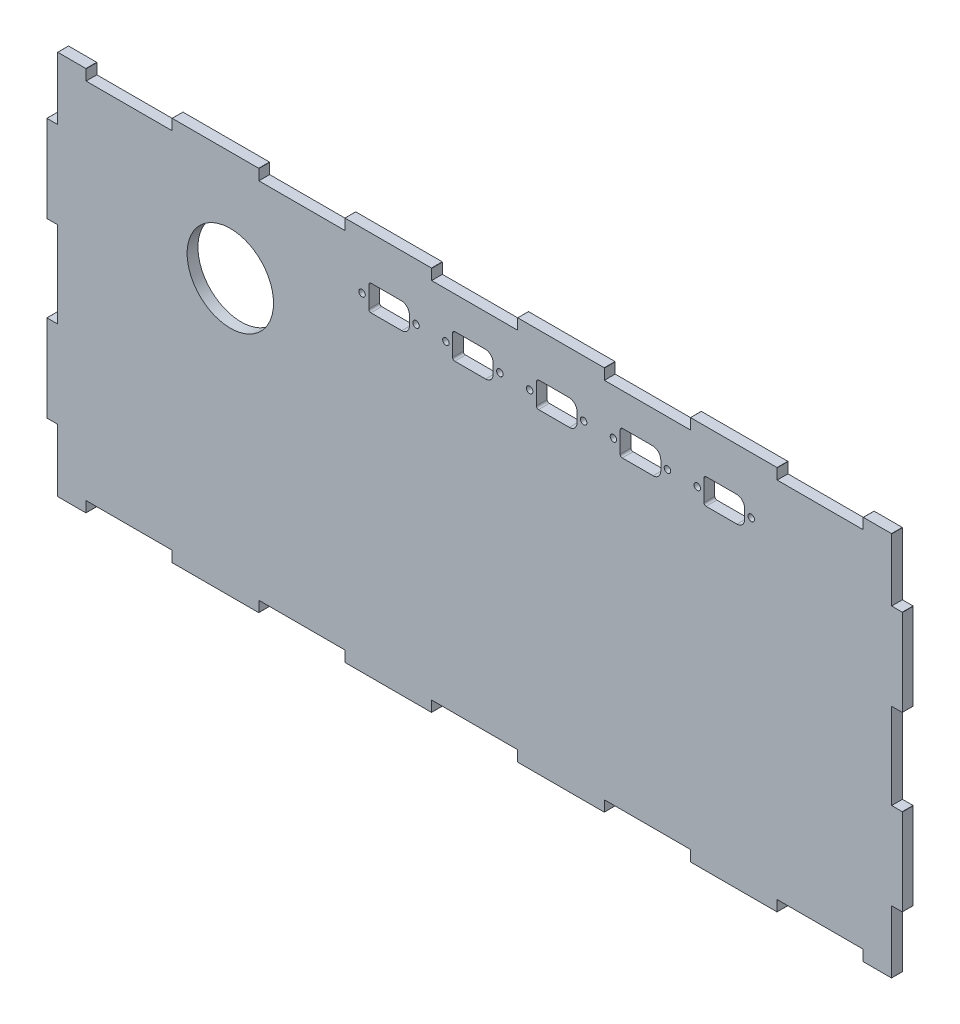
from build123d import *

# Parameters (mm, degrees)
BOSS_EXTRUDE1_DEPTH = 5
SKETCH2_R           = 1.5
CUT_EXTRUDE1_DEPTH  = 218.272685812
SKETCH3_R           = 20
CUT_EXTRUDE2_DEPTH  = 218.272685812


with BuildPart() as part:
    # Model → Boss-Extrude1 (new body)
    with BuildSketch(Plane.XY):
        Polygon((-179.94, -89.08), (-179.93, -89.07), (-179.92, -89.05), (-179.91, -89.04), (-179.9, -89.02), (-179.9, -84.1), (-140.1, -84.1), (-140.1, -89.02), (-140.08, -89.06), (-140.07, -89.07), (-140.05, -89.08), (-140.04, -89.09), (-140.02, -89.1), (-99.98, -89.1), (-99.94, -89.08), (-99.93, -89.07), (-99.92, -89.05), (-99.91, -89.04), (-99.9, -89.02), (-99.9, -84.1), (-60.1, -84.1), (-60.1, -89.02), (-60.08, -89.06), (-60.07, -89.07), (-60.05, -89.08), (-60.04, -89.09), (-60.02, -89.1), (-19.98, -89.1), (-19.94, -89.08), (-19.93, -89.07), (-19.92, -89.05), (-19.91, -89.04), (-19.9, -89.02), (-19.9, -84.1), (19.9, -84.1), (19.9, -89.02), (19.92, -89.06), (19.93, -89.07), (19.95, -89.08), (19.96, -89.09), (19.98, -89.1), (60.02, -89.1), (60.06, -89.08), (60.07, -89.07), (60.08, -89.05), (60.09, -89.04), (60.1, -89.02), (60.1, -84.1), (99.9, -84.1), (99.9, -89.02), (99.92, -89.06), (99.93, -89.07), (99.95, -89.08), (99.96, -89.09), (99.98, -89.1), (140.02, -89.1), (140.06, -89.08), (140.07, -89.07), (140.08, -89.05), (140.09, -89.04), (140.1, -89.02), (140.1, -84.1), (179.9, -84.1), (179.9, -89.02), (179.92, -89.06), (179.93, -89.07), (179.95, -89.08), (179.96, -89.09), (179.98, -89.1), (193.02, -89.1), (193.06, -89.08), (193.07, -89.07), (193.08, -89.05), (193.09, -89.04), (193.1, -89.02), (193.1, -60.1), (198.02, -60.1), (198.06, -60.08), (198.07, -60.07), (198.08, -60.05), (198.09, -60.04), (198.1, -60.02), (198.1, -19.98), (198.08, -19.94), (198.07, -19.93), (198.05, -19.92), (198.04, -19.91), (198.02, -19.9), (193.1, -19.9), (193.1, 19.9), (198.02, 19.9), (198.06, 19.92), (198.07, 19.93), (198.08, 19.95), (198.09, 19.96), (198.1, 19.98), (198.1, 60.02), (198.08, 60.06), (198.07, 60.07), (198.05, 60.08), (198.04, 60.09), (198.02, 60.1), (193.1, 60.1), (193.1, 89.02), (193.08, 89.06), (193.07, 89.07), (193.05, 89.08), (193.04, 89.09), (193.02, 89.1), (179.98, 89.1), (179.94, 89.08), (179.93, 89.07), (179.92, 89.05), (179.91, 89.04), (179.9, 89.02), (179.9, 84.1), (140.1, 84.1), (140.1, 89.02), (140.08, 89.06), (140.07, 89.07), (140.05, 89.08), (140.04, 89.09), (140.02, 89.1), (99.98, 89.1), (99.94, 89.08), (99.93, 89.07), (99.92, 89.05), (99.91, 89.04), (99.9, 89.02), (99.9, 84.1), (60.1, 84.1), (60.1, 89.02), (60.08, 89.06), (60.07, 89.07), (60.05, 89.08), (60.04, 89.09), (60.02, 89.1), (19.98, 89.1), (19.94, 89.08), (19.93, 89.07), (19.92, 89.05), (19.91, 89.04), (19.9, 89.02), (19.9, 84.1), (-19.9, 84.1), (-19.9, 89.02), (-19.92, 89.06), (-19.93, 89.07), (-19.95, 89.08), (-19.96, 89.09), (-19.98, 89.1), (-60.02, 89.1), (-60.06, 89.08), (-60.07, 89.07), (-60.08, 89.05), (-60.09, 89.04), (-60.1, 89.02), (-60.1, 84.1), (-99.9, 84.1), (-99.9, 89.02), (-99.92, 89.06), (-99.93, 89.07), (-99.95, 89.08), (-99.96, 89.09), (-99.98, 89.1), (-140.02, 89.1), (-140.06, 89.08), (-140.07, 89.07), (-140.08, 89.05), (-140.09, 89.04), (-140.1, 89.02), (-140.1, 84.1), (-179.9, 84.1), (-179.9, 89.02), (-179.92, 89.06), (-179.93, 89.07), (-179.95, 89.08), (-179.96, 89.09), (-179.98, 89.1), (-193.02, 89.1), (-193.06, 89.08), (-193.07, 89.07), (-193.08, 89.05), (-193.09, 89.04), (-193.1, 89.02), (-193.1, 60.1), (-198.02, 60.1), (-198.06, 60.08), (-198.07, 60.07), (-198.08, 60.05), (-198.09, 60.04), (-198.1, 60.02), (-198.1, 19.98), (-198.08, 19.94), (-198.07, 19.93), (-198.05, 19.92), (-198.04, 19.91), (-198.02, 19.9), (-193.1, 19.9), (-193.1, -19.9), (-198.02, -19.9), (-198.06, -19.92), (-198.07, -19.93), (-198.08, -19.95), (-198.09, -19.96), (-198.1, -19.98), (-198.1, -60.02), (-198.08, -60.06), (-198.07, -60.07), (-198.05, -60.08), (-198.04, -60.09), (-198.02, -60.1), (-193.1, -60.1), (-193.1, -89.02), (-193.08, -89.06), (-193.07, -89.07), (-193.05, -89.08), (-193.04, -89.09), (-193.02, -89.1), (-179.98, -89.1), align=None)
    extrude(amount=BOSS_EXTRUDE1_DEPTH)

    # Sketch2 → Cut-Extrude1 (cut, through all)
    with BuildSketch(Plane.XY.offset(5)):
        with Locations((-52.108840949, 62.97)):
            Circle(SKETCH2_R)
        with Locations((-27.108840949, 62.97)):
            Circle(SKETCH2_R)
        with Locations((-13.308840949, 62.97)):
            Circle(SKETCH2_R)
        with Locations((11.691159051, 62.97)):
            Circle(SKETCH2_R)
        with Locations((25.491159051, 62.97)):
            Circle(SKETCH2_R)
        with Locations((50.491159051, 62.97)):
            Circle(SKETCH2_R)
        with Locations((64.291159051, 62.97)):
            Circle(SKETCH2_R)
        with Locations((89.291159051, 62.97)):
            Circle(SKETCH2_R)
        with Locations((103.091159051, 62.97)):
            Circle(SKETCH2_R)
        with Locations((128.091159051, 62.97)):
            Circle(SKETCH2_R)
        with BuildLine():
            Line((-33.733840949, 57.12), (-48.008840949, 57.12))
            ThreePointArc((-48.008840949, 57.12), (-48.71594773, 57.412893219), (-49.008840949, 58.12))
            Line((-49.008840949, 58.12), (-49.008840949, 67.82))
            ThreePointArc((-49.008840949, 67.82), (-48.657369086, 68.668528137), (-47.808840949, 69.02))
            Line((-47.808840949, 69.02), (-33.933840949, 69.02))
            ThreePointArc((-33.933840949, 69.02), (-31.299868189, 67.92897276), (-30.208840949, 65.295))
            Line((-30.208840949, 65.295), (-30.208840949, 60.645))
            ThreePointArc((-30.208840949, 60.645), (-31.241289545, 58.152448596), (-33.733840949, 57.12))
        make_face()
        with BuildLine():
            Line((5.066159051, 57.12), (-9.208840949, 57.12))
            ThreePointArc((-9.208840949, 57.12), (-9.91594773, 57.412893219), (-10.208840949, 58.12))
            Line((-10.208840949, 58.12), (-10.208840949, 67.82))
            ThreePointArc((-10.208840949, 67.82), (-9.857369086, 68.668528137), (-9.008840949, 69.02))
            Line((-9.008840949, 69.02), (4.866159051, 69.02))
            ThreePointArc((4.866159051, 69.02), (7.500131811, 67.92897276), (8.591159051, 65.295))
            Line((8.591159051, 65.295), (8.591159051, 60.645))
            ThreePointArc((8.591159051, 60.645), (7.558710455, 58.152448596), (5.066159051, 57.12))
        make_face()
        with BuildLine():
            Line((43.866159051, 57.12), (29.591159051, 57.12))
            ThreePointArc((29.591159051, 57.12), (28.88405227, 57.412893219), (28.591159051, 58.12))
            Line((28.591159051, 58.12), (28.591159051, 67.82))
            ThreePointArc((28.591159051, 67.82), (28.942630914, 68.668528137), (29.791159051, 69.02))
            Line((29.791159051, 69.02), (43.666159051, 69.02))
            ThreePointArc((43.666159051, 69.02), (46.300131811, 67.92897276), (47.391159051, 65.295))
            Line((47.391159051, 65.295), (47.391159051, 60.645))
            ThreePointArc((47.391159051, 60.645), (46.358710455, 58.152448596), (43.866159051, 57.12))
        make_face()
        with BuildLine():
            Line((82.666159051, 57.12), (68.391159051, 57.12))
            ThreePointArc((68.391159051, 57.12), (67.68405227, 57.412893219), (67.391159051, 58.12))
            Line((67.391159051, 58.12), (67.391159051, 67.82))
            ThreePointArc((67.391159051, 67.82), (67.742630914, 68.668528137), (68.591159051, 69.02))
            Line((68.591159051, 69.02), (82.466159051, 69.02))
            ThreePointArc((82.466159051, 69.02), (85.100131811, 67.92897276), (86.191159051, 65.295))
            Line((86.191159051, 65.295), (86.191159051, 60.645))
            ThreePointArc((86.191159051, 60.645), (85.158710455, 58.152448596), (82.666159051, 57.12))
        make_face()
        with BuildLine():
            Line((121.466159051, 57.12), (107.191159051, 57.12))
            ThreePointArc((107.191159051, 57.12), (106.48405227, 57.412893219), (106.191159051, 58.12))
            Line((106.191159051, 58.12), (106.191159051, 67.82))
            ThreePointArc((106.191159051, 67.82), (106.542630914, 68.668528137), (107.391159051, 69.02))
            Line((107.391159051, 69.02), (121.266159051, 69.02))
            ThreePointArc((121.266159051, 69.02), (123.900131811, 67.92897276), (124.991159051, 65.295))
            Line((124.991159051, 65.295), (124.991159051, 60.645))
            ThreePointArc((124.991159051, 60.645), (123.958710455, 58.152448596), (121.466159051, 57.12))
        make_face()
    extrude(amount=-CUT_EXTRUDE1_DEPTH, mode=Mode.SUBTRACT)

    # Sketch3 → Cut-Extrude2 (cut, through all)
    with BuildSketch(Plane.XY.offset(5)):
        with Locations((-113.1, 38.4)):
            Circle(SKETCH3_R)
    extrude(amount=-CUT_EXTRUDE2_DEPTH, mode=Mode.SUBTRACT)


solid = part.part
